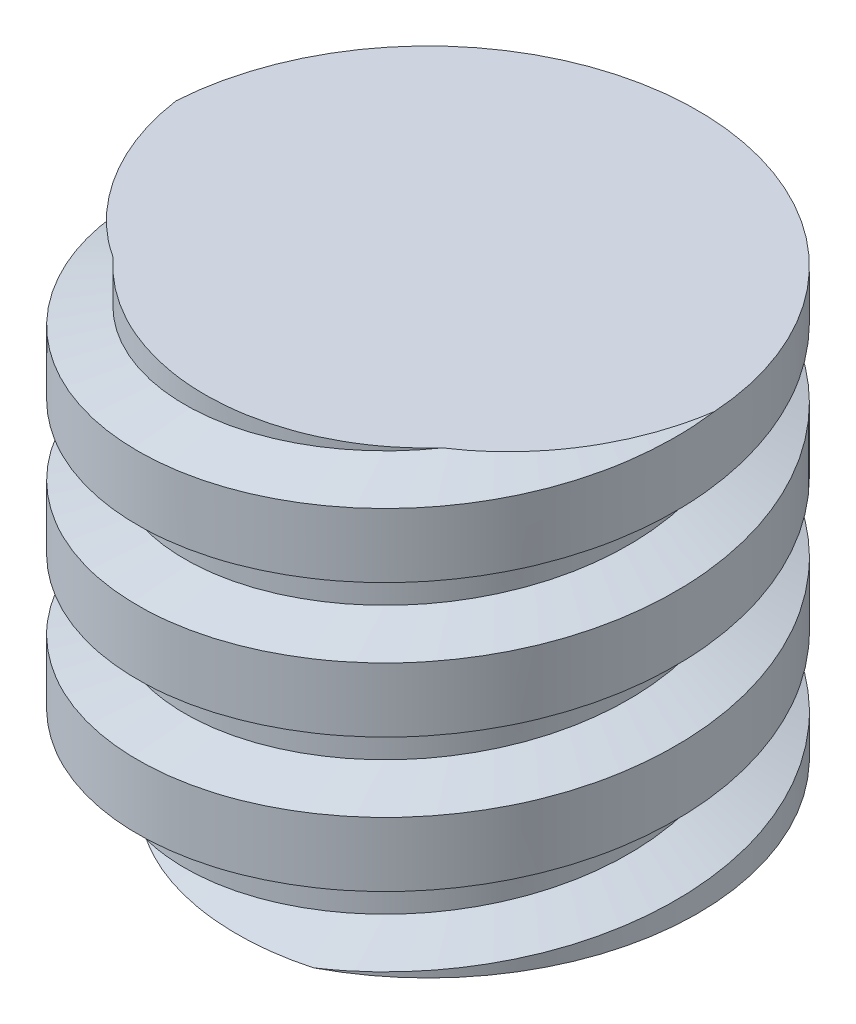
from build123d import *

# Parameters (mm, degrees)
SKETCH_3_W    = 9.5
SKETCH_3_H    = 15
SWEEP_1_PITCH = 4.712


with BuildPart() as part:
    # Эскиз3 → Повернуть1 (revolve)
    with BuildSketch(Plane.XY, mode=Mode.PRIVATE) as revolve_1_sk:
        with Locations((4.75, 7.5)):
            Rectangle(SKETCH_3_W, SKETCH_3_H)
    revolve(revolve_1_sk.sketch.rotate(Axis((0, 0, 0), (0, 1, 0)), 90), axis=Axis((0, 0, 0), (0, 1, 0)))

    # Вырез-По траектории1: arcs per turn and ends read off the stored shape
    # Вырез-По траектории1: the profile of Эскиз7 screwed along a right-hand helix through 8.75 turns, 12 arcs to a turn; built about Z, then put on its axis
    sweep_1_z = Axis((0, 0, 0), (0, 0, 1))
    sweep_1_corners = [(7.85, 0, -4.087550887), (7.85, 0, -5.336449113), (11.15, 0, -6.537550887), (11.15, 0, -2.886449113)]
    with BuildLine(mode=Mode.PRIVATE) as sweep_1_profile:
        Line(sweep_1_corners[0], sweep_1_corners[1])
        Line(sweep_1_corners[1], sweep_1_corners[2])
        Line(sweep_1_corners[2], sweep_1_corners[3])
        Line(sweep_1_corners[3], sweep_1_corners[0])
    sweep_1_cap = Face(sweep_1_profile.wire())
    sweep_1_turn_angles = [0, 15, 30, 45, 60, 75, 90, 105, 120, 135, 150, 165, 180, 195, 210, 225, 240, 255, 270, 285, 300, 315, 330, 345, 360]
    sweep_1_turn_weights = [1, 0.9659258262890683, 1, 0.9659258262890683, 1, 0.9659258262890683, 1, 0.9659258262890683, 1, 0.9659258262890683, 1, 0.9659258262890683, 1, 0.9659258262890683, 1, 0.9659258262890683, 1, 0.9659258262890683, 1, 0.9659258262890683, 1, 0.9659258262890683, 1, 0.9659258262890683, 1]
    sweep_1_turn_rails = [Edge.make_bspline([Vector(p[0], p[1], 0).rotate(sweep_1_z, sweep_1_turn_angles[k]) / sweep_1_turn_weights[k] + Vector(0, 0, p[2] + SWEEP_1_PITCH * sweep_1_turn_angles[k] / 360) for k in range(25)], [0, 0, 0, 1, 1, 2, 2, 3, 3, 4, 4, 5, 5, 6, 6, 7, 7, 8, 8, 9, 9, 10, 10, 11, 11, 12, 12, 12], 2, sweep_1_turn_weights) for p in sweep_1_corners]
    sweep_1_turn_sides = [Face.make_surface_from_curves(sweep_1_turn_rails[p[0]], sweep_1_turn_rails[p[1]]) for p in [(0, 1), (1, 2), (2, 3), (3, 0)]]
    sweep_1_last_angles = [2880, 2895, 2910, 2925, 2940, 2955, 2970, 2985, 3000, 3015, 3030, 3045, 3060, 3075, 3090, 3105, 3120, 3135, 3150]
    sweep_1_last_weights = [1, 0.9659258262890683, 1, 0.9659258262890683, 1, 0.9659258262890683, 1, 0.9659258262890683, 1, 0.9659258262890683, 1, 0.9659258262890683, 1, 0.9659258262890683, 1, 0.9659258262890683, 1, 0.9659258262890683, 1]
    sweep_1_last_rails = [Edge.make_bspline([Vector(p[0], p[1], 0).rotate(sweep_1_z, sweep_1_last_angles[k]) / sweep_1_last_weights[k] + Vector(0, 0, p[2] + SWEEP_1_PITCH * sweep_1_last_angles[k] / 360) for k in range(19)], [0, 0, 0, 1, 1, 2, 2, 3, 3, 4, 4, 5, 5, 6, 6, 7, 7, 8, 8, 9, 9, 9], 2, sweep_1_last_weights) for p in sweep_1_corners]
    sweep_1_last_sides = [Face.make_surface_from_curves(sweep_1_last_rails[p[0]], sweep_1_last_rails[p[1]]) for p in [(0, 1), (1, 2), (2, 3), (3, 0)]]
    sweep_1 = Plane(origin=(0, 15, 0), x_dir=(0, 0, 1), z_dir=(0, -1, 0)) * Solid(Shell([*[p.moved(Location((0, 0, SWEEP_1_PITCH * i))) for i in range(8) for p in sweep_1_turn_sides], *sweep_1_last_sides, sweep_1_cap, sweep_1_cap.rotate(sweep_1_z, 3150).moved(Location((0, 0, SWEEP_1_PITCH * 3150 / 360)))]))
    add(sweep_1, mode=Mode.SUBTRACT)


solid = part.part
